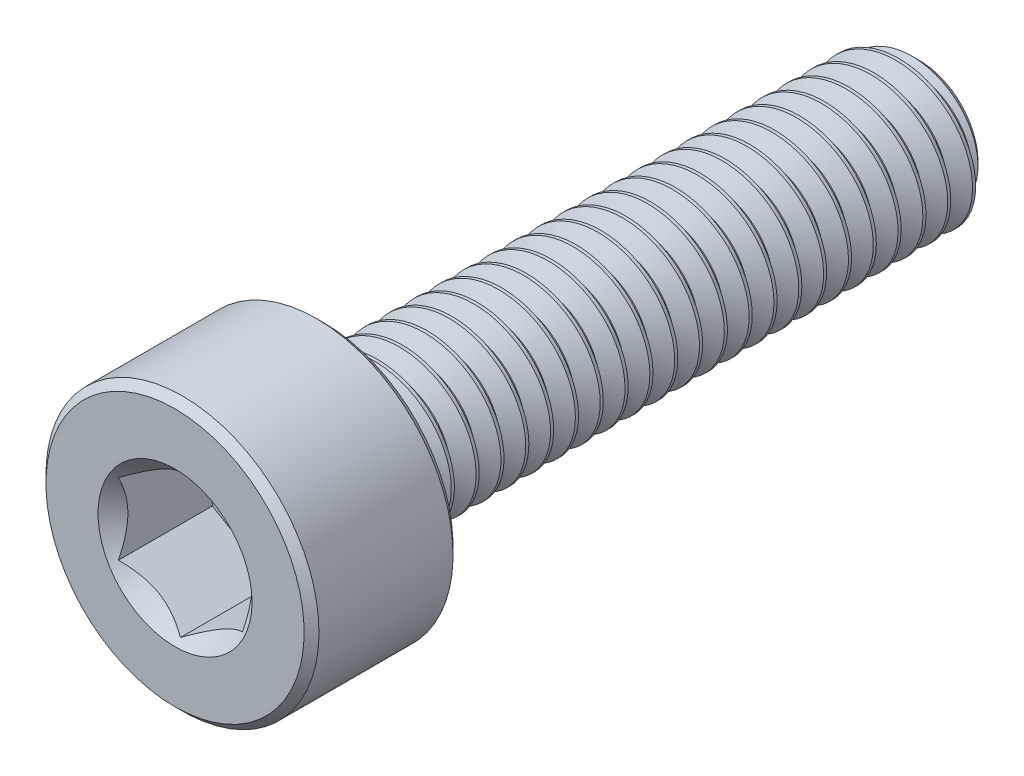
from build123d import *

# Parameters (mm, degrees)
CUT_EXTRUDE1_DEPTH     = 2
SKETCH4_R              = 1.551628848
CUT_EXTRUDE2_DEPTH     = 1.5
CUT_EXTRUDE2_DRAFT     = -45
SPLIT1_SURFACE_1_BACK  = 17.897
SPLIT1_SURFACE_1_DEPTH = 35.794
SPLIT1_SURFACE_2_BACK  = 17.897
SPLIT1_SURFACE_2_DEPTH = 35.794
CUT_SWEEP1_PITCH       = 0.5


with BuildPart() as part:
    # Sketch2 → Revolve1 (revolve)
    with BuildSketch(Plane(origin=(0, 0, 0), x_dir=(0, 0, -1), z_dir=(1, 0, 0))):
        with BuildLine():
            Line((-7.5, 0), (-7.5, 2.6))
            Line((-7.5, 2.6), (-7.35, 2.75))
            Line((-7.35, 2.75), (-4.65, 2.75))
            Line((-4.65, 2.75), (-4.5, 2.6))
            Line((-4.5, 2.6), (-4.5, 1.65))
            ThreePointArc((-4.5, 1.65), (-4.456066017, 1.543933983), (-4.35, 1.5))
            Line((-4.35, 1.5), (7.175240474, 1.5))
            Line((7.175240474, 1.5), (7.5, 1.175240474))
            Line((7.5, 1.175240474), (7.5, 0))
            Line((7.5, 0), (-7.5, 0))
        make_face()
    revolve(axis=Axis((0, 0, -7.5), (0, 0, 1)))

    # Sketch3 → Cut-Extrude1 (cut)
    with BuildSketch(Plane.XY.offset(7.5)):
        Polygon((1.25, -0.721687836), (1.25, 0.721687836), (0, 1.443375673), (-1.25, 0.721687836), (-1.25, -0.721687836), (0, -1.443375673), align=None)
    extrude(amount=-CUT_EXTRUDE1_DEPTH, mode=Mode.SUBTRACT)


with BuildPart() as cut_extrude2_tool:
    # Sketch4 → Cut-Extrude2 (with draft: the straight prism first)
    with BuildSketch(Plane.XY.offset(7.5)):
        Circle(SKETCH4_R)
    extrude(amount=-CUT_EXTRUDE2_DEPTH)
    # Cut-Extrude2: the draft: its side faces are tilted about the plane it starts from
    cut_extrude2_sides = [cut_extrude2_tool.faces().sort_by_distance(p)[0] for p in [
        (-1.551628848, 0, 6.75),
    ]]
    draft(cut_extrude2_sides, Plane.XY.offset(7.5), CUT_EXTRUDE2_DRAFT)


with BuildPart() as part_1:
    add(part.part)

    # Cut-Extrude2: cut by cut_extrude2_tool
    add(cut_extrude2_tool.part, mode=Mode.SUBTRACT)


with BuildPart() as body_2:
    # Split1: the piece behind the surface
    add(part_1.part)
    # Split1 surface: a surface, the sketch's curves swept straight by 35.794 mm
    with BuildLine(Plane(origin=(0, 0, 0), x_dir=(0, 0, -1), z_dir=(1, 0, 0)).offset(-SPLIT1_SURFACE_1_BACK), mode=Mode.PRIVATE) as split1_surface_1_path:
        Line((-4.35, -2.75), (-4.35, 2.75))
    split1_surface_1 = Shell.extrude(split1_surface_1_path.wire(), (1 * SPLIT1_SURFACE_1_DEPTH, 0 * SPLIT1_SURFACE_1_DEPTH, 0 * SPLIT1_SURFACE_1_DEPTH))
    split(bisect_by=split1_surface_1, keep=Keep.BOTTOM)

    # Cut-Sweep1: the profile of Sketch7 screwed along a right-hand helix of 25 turns, 6 arcs to a turn; built about Z, then put on its axis
    cut_sweep1_z = Axis((0, 0, 0), (0, 0, 1))
    cut_sweep1_corners = [(1.527063294, 0, 0.015625), (1.527063294, 0, -0.453125), (1.175240474, 0, -0.25), (1.175240474, 0, -0.1875)]
    with BuildLine(mode=Mode.PRIVATE) as cut_sweep1_profile:
        Line(cut_sweep1_corners[0], cut_sweep1_corners[1])
        Line(cut_sweep1_corners[1], cut_sweep1_corners[2])
        Line(cut_sweep1_corners[2], cut_sweep1_corners[3])
        Line(cut_sweep1_corners[3], cut_sweep1_corners[0])
    cut_sweep1_cap = Face(cut_sweep1_profile.wire())
    cut_sweep1_turn_angles = [0, 30, 60, 90, 120, 150, 180, 210, 240, 270, 300, 330, 360]
    cut_sweep1_turn_weights = [1, 0.8660254037844387, 1, 0.8660254037844387, 1, 0.8660254037844387, 1, 0.8660254037844387, 1, 0.8660254037844387, 1, 0.8660254037844387, 1]
    cut_sweep1_turn_rails = [Edge.make_bspline([Vector(p[0], p[1], 0).rotate(cut_sweep1_z, cut_sweep1_turn_angles[k]) / cut_sweep1_turn_weights[k] + Vector(0, 0, p[2] + CUT_SWEEP1_PITCH * cut_sweep1_turn_angles[k] / 360) for k in range(13)], [0, 0, 0, 1, 1, 2, 2, 3, 3, 4, 4, 5, 5, 6, 6, 6], 2, cut_sweep1_turn_weights) for p in cut_sweep1_corners]
    cut_sweep1_turn_sides = [Face.make_surface_from_curves(cut_sweep1_turn_rails[p[0]], cut_sweep1_turn_rails[p[1]]) for p in [(0, 1), (1, 2), (2, 3), (3, 0)]]
    cut_sweep1 = Plane(origin=(0, 0, -7.5), x_dir=(0, 1, 0), z_dir=(0, 0, 1)) * Solid(Shell([*[p.moved(Location((0, 0, CUT_SWEEP1_PITCH * i))) for i in range(25) for p in cut_sweep1_turn_sides], cut_sweep1_cap, cut_sweep1_cap.rotate(cut_sweep1_z, 9000).moved(Location((0, 0, CUT_SWEEP1_PITCH * 9000 / 360)))]))
    add(cut_sweep1, mode=Mode.SUBTRACT)


with BuildPart() as part_2:
    add(part_1.part)

    # Split1: split by a surface, the side it looks to stays
    # Split1 surface: a surface, the sketch's curves swept straight by 35.794 mm
    with BuildLine(Plane(origin=(0, 0, 0), x_dir=(0, 0, -1), z_dir=(1, 0, 0)).offset(-SPLIT1_SURFACE_2_BACK), mode=Mode.PRIVATE) as split1_surface_2_path:
        Line((-4.35, -2.75), (-4.35, 2.75))
    split1_surface_2 = Shell.extrude(split1_surface_2_path.wire(), (1 * SPLIT1_SURFACE_2_DEPTH, 0 * SPLIT1_SURFACE_2_DEPTH, 0 * SPLIT1_SURFACE_2_DEPTH))
    split(bisect_by=split1_surface_2, keep=Keep.TOP)

    add(body_2.part)  # Revolve2 merges body 2
    # Sketch8 → Revolve2 (revolve)
    with BuildSketch(Plane(origin=(0, 0, 0), x_dir=(0, 0, -1), z_dir=(1, 0, 0))):
        Polygon((-4.5, 0), (-4.5, 1.5), (-4.35, 1.5), (-3.483974596, 0), align=None)
    revolve(axis=Axis((0, 0, 3.483974596), (0, 0, 1)))


solid = part_2.part
